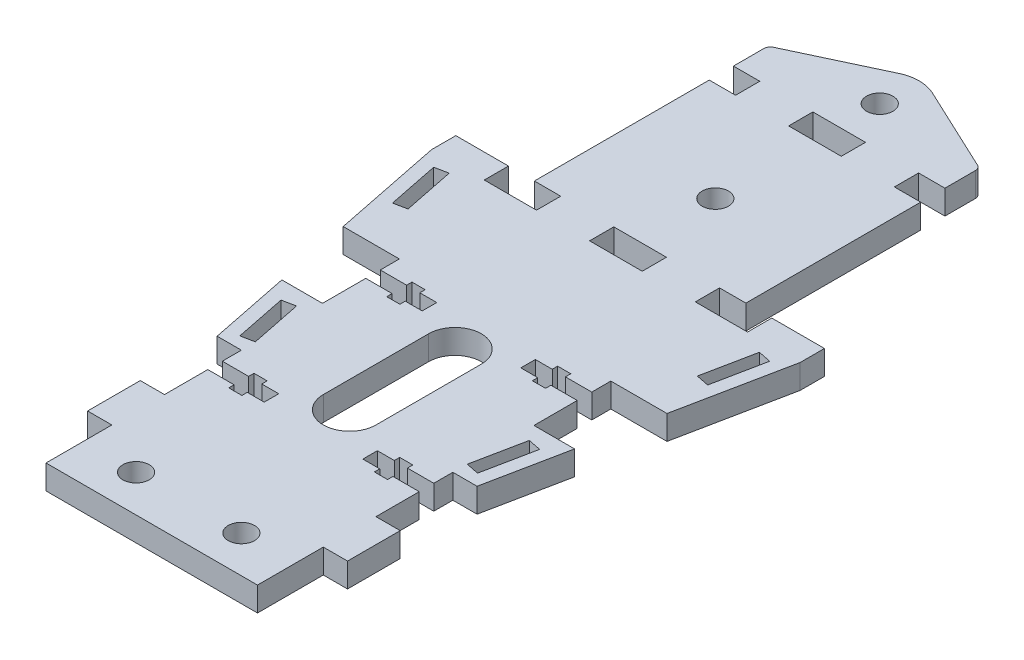
from build123d import *

# Parameters (mm, degrees)
SKETCH1_R           = 3.175
SKETCH1_W           = 12.7
SKETCH1_H           = 5.842
BOSS_EXTRUDE1_DEPTH = 5.842
CUT_EXTRUDE1_DEPTH  = 110.476906074
FILLET1_R           = 1.5875
CUT_EXTRUDE2_DEPTH  = 110.476906074


with BuildPart() as part:
    # Sketch1 → Boss-Extrude1 (new body)
    with BuildSketch(Plane(origin=(0, 0, 0), x_dir=(1, 0, 0), z_dir=(0, 1, 0))):
        with BuildLine():
            Line((31.75, 26.724230903), (25.5, 26.724230903))
            Line((25.5, 26.724230903), (19.15, 26.724230903))
            Line((19.15, 26.724230903), (19.15, 32.566230903))
            Line((19.15, 32.566230903), (25.5, 32.566230903))
            Line((25.5, 32.566230903), (25.5, 74.730230903))
            Line((25.5, 74.730230903), (19.15, 74.730230903))
            Line((19.15, 74.730230903), (19.15, 80.572230903))
            Line((19.15, 80.572230903), (25.5, 80.572230903))
            Line((25.5, 80.572230903), (25.5, 88.9))
            Line((25.5, 88.9), (4.048541401, 98.97300204))
            ThreePointArc((4.048541401, 98.97300204), (0, 99.876230903), (-4.048541401, 98.97300204))
            Line((-4.048541401, 98.97300204), (-25.5, 88.9))
            Line((-25.5, 88.9), (-25.5, 80.572230903))
            Line((-25.5, 80.572230903), (-19.15, 80.572230903))
            Line((-19.15, 80.572230903), (-19.15, 74.730230903))
            Line((-19.15, 74.730230903), (-25.5, 74.730230903))
            Line((-25.5, 74.730230903), (-25.5, 32.566230903))
            Line((-25.5, 32.566230903), (-19.15, 32.566230903))
            Line((-19.15, 32.566230903), (-19.15, 26.724230903))
            Line((-19.15, 26.724230903), (-25.5, 26.724230903))
            Line((-25.5, 26.724230903), (-31.75, 26.724230903))
            Line((-31.75, 26.724230903), (-31.75, 32.566230903))
            Line((-31.75, 32.566230903), (-44.45, 32.566230903))
            Line((-44.45, 32.566230903), (-44.45, 26.724230903))
            Line((-44.45, 26.724230903), (-39.046137682, 0))
            Line((-39.046137682, 0), (-31.342, 0))
            Line((-31.342, 0), (-25.5, 0))
            Line((-25.5, 0), (-25.5, -18.542))
            Line((-25.5, -18.542), (-31.342, -18.542))
            Line((-31.342, -18.542), (-35.296790677, -18.542))
            Line((-35.296790677, -18.542), (-31.342, -38.1))
            Line((-31.342, -38.1), (-25.5, -38.1))
            Line((-25.5, -38.1), (-25.5, -56.642))
            Line((-25.5, -56.642), (-31.342, -56.642))
            Line((-31.342, -56.642), (-31.342, -69.342))
            Line((-31.342, -69.342), (-25.5, -69.342))
            Line((-25.5, -69.342), (-25.5, -85.217))
            Line((-25.5, -85.217), (25.5, -85.217))
            Line((25.5, -85.217), (25.5, -69.342))
            Line((25.5, -69.342), (31.342, -69.342))
            Line((31.342, -69.342), (31.342, -56.642))
            Line((31.342, -56.642), (25.5, -56.642))
            Line((25.5, -56.642), (25.5, -38.1))
            Line((25.5, -38.1), (31.342, -38.1))
            Line((31.342, -38.1), (35.296790677, -18.542))
            Line((35.296790677, -18.542), (31.342, -18.542))
            Line((31.342, -18.542), (25.5, -18.542))
            Line((25.5, -18.542), (25.5, 0))
            Line((25.5, 0), (31.342, 0))
            Line((31.342, 0), (39.046137682, 0))
            Line((39.046137682, 0), (44.45, 26.724230903))
            Line((44.45, 26.724230903), (44.45, 32.566230903))
            Line((44.45, 32.566230903), (31.75, 32.566230903))
            Line((31.75, 32.566230903), (31.75, 26.724230903))
        make_face()
        with Locations((0, 90.351230903)):
            Circle(SKETCH1_R, mode=Mode.SUBTRACT)
        with Locations((0, 50.703608903)):
            Circle(SKETCH1_R, mode=Mode.SUBTRACT)
        with Locations((-12.7, -76.296391097)):
            Circle(SKETCH1_R, mode=Mode.SUBTRACT)
        with Locations((12.7, -76.296391097)):
            Circle(SKETCH1_R, mode=Mode.SUBTRACT)
        with Locations((0, 77.651230903)):
            Rectangle(SKETCH1_W, SKETCH1_H, mode=Mode.SUBTRACT)
        with BuildLine():
            Line((6.35, -12.086080097), (6.35, -37.486080097))
            ThreePointArc((6.35, -37.486080097), (0, -43.836080097), (-6.35, -37.486080097))
            Line((-6.35, -37.486080097), (-6.35, -12.086080097))
            ThreePointArc((-6.35, -12.086080097), (0, -5.736080097), (6.35, -12.086080097))
        make_face(mode=Mode.SUBTRACT)
        with Locations((0, 29.645230903)):
            Rectangle(SKETCH1_W, SKETCH1_H, mode=Mode.SUBTRACT)
    extrude(amount=BOSS_EXTRUDE1_DEPTH)

    # Sketch2 → Cut-Extrude1 (cut, through all)
    with BuildSketch(Plane(origin=(0, 5.842, 0), x_dir=(1, 0, 0), z_dir=(0, 1, 0))):
        Polygon((-15.975, -42.6974), (-15.975, -41.402), (-19.15, -41.402), (-19.15, -42.6974), (-25.5, -42.6974), (-25.5, -46.2026), (-19.15, -46.2026), (-19.15, -47.498), (-15.975, -47.498), (-15.975, -46.2026), (-11.891999892, -46.2026), (-11.891999892, -42.6974), align=None)
        Polygon((-19.15, -8.1026), (-19.15, -9.398), (-15.975, -9.398), (-15.975, -8.1026), (-11.891999892, -8.1026), (-11.891999892, -4.5974), (-15.975, -4.5974), (-15.975, -3.302), (-19.15, -3.302), (-19.15, -4.5974), (-25.5, -4.5974), (-25.5, -8.1026), align=None)
        Polygon((15.975, -8.1026), (15.975, -9.398), (19.15, -9.398), (19.15, -8.1026), (25.5, -8.1026), (25.5, -4.5974), (19.15, -4.5974), (19.15, -3.302), (15.975, -3.302), (15.975, -4.5974), (11.891999892, -4.5974), (11.891999892, -8.1026), align=None)
        Polygon((19.15, -42.6974), (19.15, -41.402), (15.975, -41.402), (15.975, -42.6974), (11.891999892, -42.6974), (11.891999892, -46.2026), (15.975, -46.2026), (15.975, -47.498), (19.15, -47.498), (19.15, -46.2026), (25.5, -46.2026), (25.5, -42.6974), align=None)
    extrude(amount=-CUT_EXTRUDE1_DEPTH, mode=Mode.SUBTRACT)

    # Fillet1
    fillet1_edges = [part.edges().sort_by_distance(p)[0] for p in [
        (25.5, 2.921, -88.9),
        (-25.5, 2.921, -88.9),
    ]]
    fillet(fillet1_edges, radius=FILLET1_R)

    # Sketch3 → Cut-Extrude2 (cut, through all)
    with BuildSketch(Plane(origin=(0, 5.842, 0), x_dir=(1, 0, 0), z_dir=(0, 1, 0))):
        Polygon((-40.517842499, 23.29757819), (-38.000740957, 10.849518107), (-34.888725936, 11.478793492), (-37.405827478, 23.926853575), align=None)
        Polygon((-25.556378249, -34.673347287), (-28.073479791, -22.225287204), (-31.185494812, -22.854562589), (-28.66839327, -35.302622672), align=None)
        Polygon((28.66839327, -35.302622672), (31.185494812, -22.854562589), (28.073479791, -22.225287204), (25.556378249, -34.673347287), align=None)
        Polygon((37.405827478, 23.926853575), (34.888725936, 11.478793492), (38.000740957, 10.849518107), (40.517842499, 23.29757819), align=None)
    extrude(amount=-CUT_EXTRUDE2_DEPTH, mode=Mode.SUBTRACT)


solid = part.part
